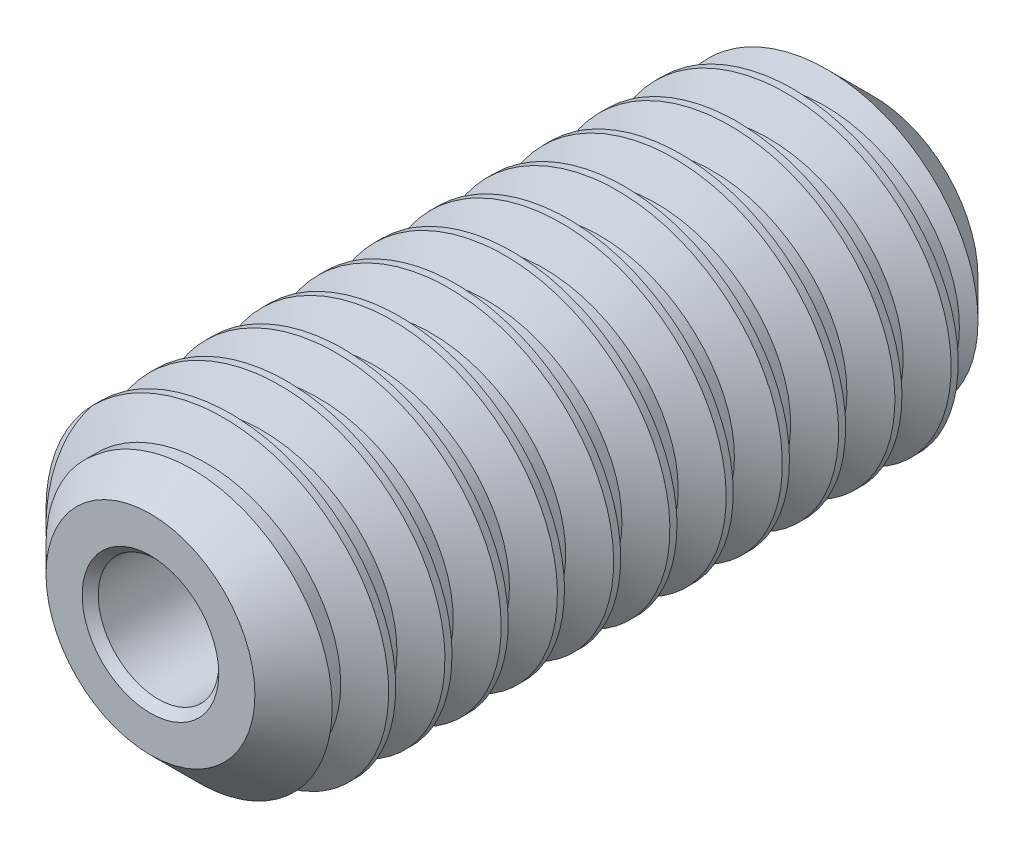
from build123d import *

# Parameters (mm, degrees)
BREZON_PROFILE_R       = 2
BREZON_BODY_DEPTH      = 9
AESTHETIC_CHAMFER_SIZE = 0.7
THREAD_M4X0_7_PITCH    = 0.7


with BuildPart() as part:
    # Brezon Profile → Brezon Body (new body)
    with BuildSketch(Plane.XY):
        Circle(BREZON_PROFILE_R)
    extrude(amount=-BREZON_BODY_DEPTH)

    # Aesthetic Chamfer
    aesthetic_chamfer_edges = [part.edges().sort_by_distance(p)[0] for p in [
        (-2, 0, 0),
        (-2, 0, -9),
    ]]
    chamfer(aesthetic_chamfer_edges, length=AESTHETIC_CHAMFER_SIZE)

    # Sketch3 → Grease Hole (revolve, cut)
    with BuildSketch(Plane(origin=(0, 0, 0), x_dir=(0, -1, 0), z_dir=(1, 0, 0))):
        Polygon((0, 0), (0, 9), (0.85, 9), (0.75, 8.9), (0.75, 0.1), (0.85, 0), align=None)
    revolve(axis=Axis((0, 0, 6.35), (0, 0, -1)), mode=Mode.SUBTRACT)

    # Thread M4x0.7: the profile of Thread Profile1 profile screwed along a right-hand helix of 21.428571 turns, 6 arcs to a turn; built about Z, then put on its axis
    thread_m4x0_7_z = Axis((0, 0, 0), (0, 0, 1))
    thread_m4x0_7_corners = [(2.0003, 0, -0.000173205), (2.0003, 0, 0.612673203), (1.621113887, 0, 0.393749999), (1.621113887, 0, 0.218749999)]
    with BuildLine(mode=Mode.PRIVATE) as thread_m4x0_7_profile:
        Line(thread_m4x0_7_corners[0], thread_m4x0_7_corners[1])
        Line(thread_m4x0_7_corners[1], thread_m4x0_7_corners[2])
        Line(thread_m4x0_7_corners[2], thread_m4x0_7_corners[3])
        Line(thread_m4x0_7_corners[3], thread_m4x0_7_corners[0])
    thread_m4x0_7_cap = Face(thread_m4x0_7_profile.wire())
    thread_m4x0_7_turn_angles = [0, 30, 60, 90, 120, 150, 180, 210, 240, 270, 300, 330, 360]
    thread_m4x0_7_turn_weights = [1, 0.8660254037844387, 1, 0.8660254037844387, 1, 0.8660254037844387, 1, 0.8660254037844387, 1, 0.8660254037844387, 1, 0.8660254037844387, 1]
    thread_m4x0_7_turn_rails = [Edge.make_bspline([Vector(p[0], p[1], 0).rotate(thread_m4x0_7_z, thread_m4x0_7_turn_angles[k]) / thread_m4x0_7_turn_weights[k] + Vector(0, 0, p[2] + THREAD_M4X0_7_PITCH * thread_m4x0_7_turn_angles[k] / 360) for k in range(13)], [0, 0, 0, 1, 1, 2, 2, 3, 3, 4, 4, 5, 5, 6, 6, 6], 2, thread_m4x0_7_turn_weights) for p in thread_m4x0_7_corners]
    thread_m4x0_7_turn_sides = [Face.make_surface_from_curves(thread_m4x0_7_turn_rails[p[0]], thread_m4x0_7_turn_rails[p[1]]) for p in [(0, 1), (1, 2), (2, 3), (3, 0)]]
    thread_m4x0_7_last_angles = [7560, 7590, 7620, 7650, 7680, 7697.142857143, 7714.285714286]
    thread_m4x0_7_last_weights = [1, 0.8660254037844387, 1, 0.8660254037844387, 1, 0.9555728057861397, 1]
    thread_m4x0_7_last_rails = [Edge.make_bspline([Vector(p[0], p[1], 0).rotate(thread_m4x0_7_z, thread_m4x0_7_last_angles[k]) / thread_m4x0_7_last_weights[k] + Vector(0, 0, p[2] + THREAD_M4X0_7_PITCH * thread_m4x0_7_last_angles[k] / 360) for k in range(7)], [0, 0, 0, 1, 1, 2, 2, 3, 3, 3], 2, thread_m4x0_7_last_weights) for p in thread_m4x0_7_corners]
    thread_m4x0_7_last_sides = [Face.make_surface_from_curves(thread_m4x0_7_last_rails[p[0]], thread_m4x0_7_last_rails[p[1]]) for p in [(0, 1), (1, 2), (2, 3), (3, 0)]]
    thread_m4x0_7 = Plane(origin=(0, 0, 0.7), x_dir=(-1, 0, 0), z_dir=(0, 0, -1)) * Solid(Shell([*[p.moved(Location((0, 0, THREAD_M4X0_7_PITCH * i))) for i in range(21) for p in thread_m4x0_7_turn_sides], *thread_m4x0_7_last_sides, thread_m4x0_7_cap, thread_m4x0_7_cap.rotate(thread_m4x0_7_z, 7714.285714286).moved(Location((0, 0, THREAD_M4X0_7_PITCH * 7714.285714286 / 360)))]))
    add(thread_m4x0_7, mode=Mode.SUBTRACT)


solid = part.part
